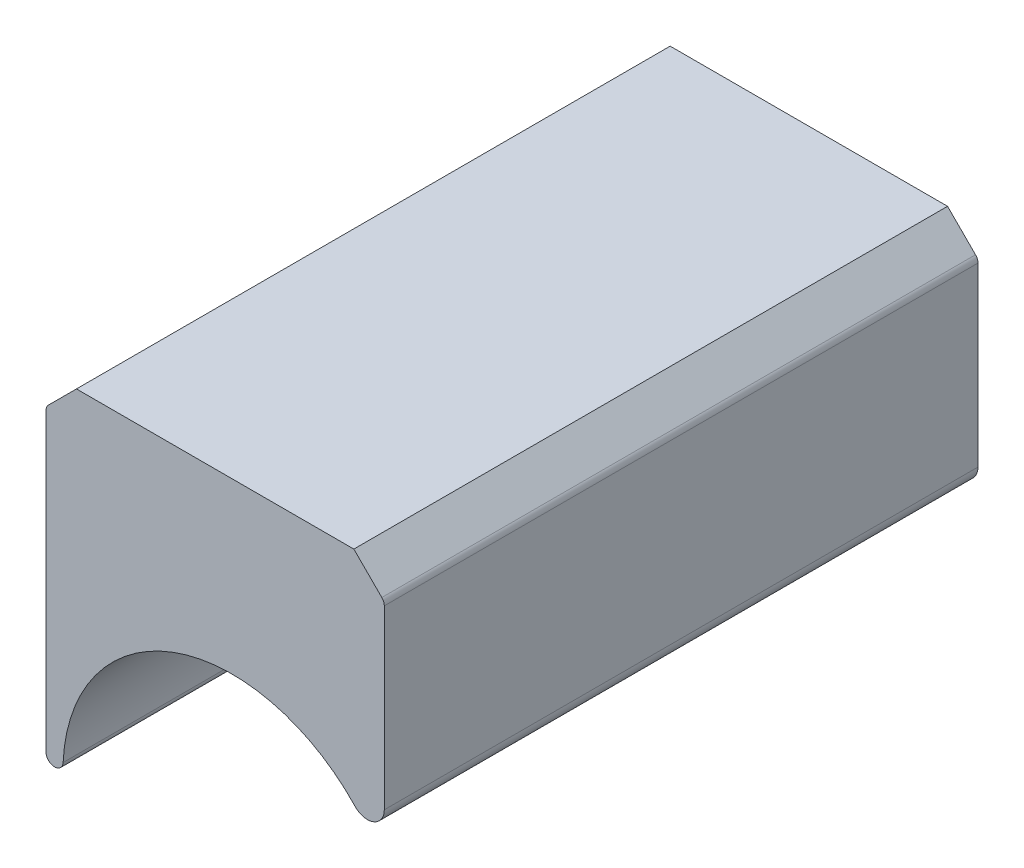
from build123d import *

# Parameters (mm, degrees)
BOSS_EXTRUDE2_DEPTH = 35.1
CUT_EXTRUDE2_DEPTH  = 23.1
CHAMFER1_SIZE       = 1.8
FILLET1_R           = 20
FILLET2_R           = 0.5
FILLET3_R           = 1


with BuildPart() as part:
    # Sketch1 → Boss-Extrude2 (new body)
    with BuildSketch(Plane.XY):
        with BuildLine():
            Line((0, 0), (1, 0))
            ThreePointArc((1, 0), (8.763932023, 9.746794345), (20, 4.358898944))
            Line((20, 4.358898944), (20, 20))
            Line((20, 20), (0, 20))
            Line((0, 20), (0, 0))
        make_face()
    extrude(amount=BOSS_EXTRUDE2_DEPTH)

    # Sketch2 → Cut-Extrude2 (cut)
    with BuildSketch(Plane.ZY):
        Polygon((0, 0), (0, 6), (6, 6), (17, 0), align=None)
    extrude(amount=-CUT_EXTRUDE2_DEPTH, mode=Mode.SUBTRACT)

    # Chamfer1
    chamfer1_edges = [part.edges().sort_by_distance(p)[0] for p in [
        (20, 20, 17.55),
        (0, 20, 17.55),
    ]]
    chamfer(chamfer1_edges, length=CHAMFER1_SIZE)

    # Fillet1
    fillet1_edges = [part.edges().sort_by_distance(p)[0] for p in [
        (0.5, 0, 17),
        (1.5, 6, 6),
    ]]
    fillet(fillet1_edges, radius=FILLET1_R)

    # Fillet2
    fillet2_edges = [part.edges().sort_by_distance(p)[0] for p in [
        (0, 18.2, 17.55),
        (20, 18.2, 17.55),
        (3, 6, 0.450059856),
        (2.565797796, 5.372544388, 5.870484279),
        (1.461007158, 3.001268991, 11.497673517),
        (1.019341108, 0.621649581, 17.15220052),
        (1, 0, 28.599940144),
        (0, 0, 28.599940144),
        (0, 0.620136363, 17.158131061),
        (0, 3, 11.5),
        (0, 5.379863637, 5.841868939),
        (0, 6, 0.450059856),
    ]]
    fillet(fillet2_edges, radius=FILLET2_R)

    # Fillet3
    fillet3_edges = [part.edges().sort_by_distance(p)[0] for p in [
        (20, 4.358898944, 22.054342635),
    ]]
    fillet(fillet3_edges, radius=FILLET3_R)


solid = part.part
